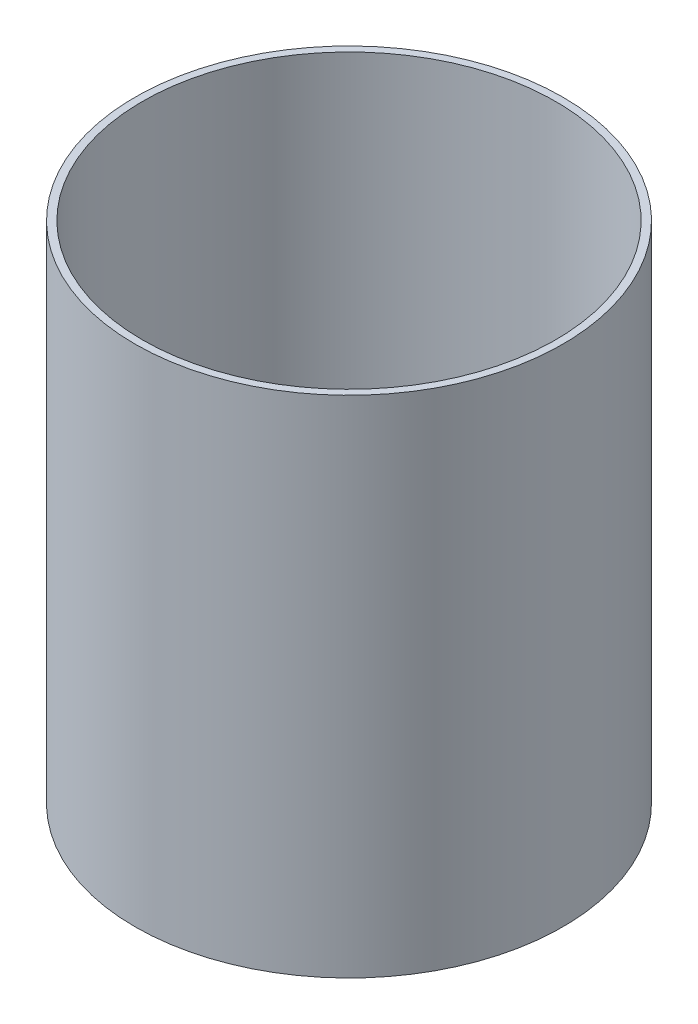
from build123d import *

# Parameters (mm, degrees)
SKETCH1_R           = 109.5375
SKETCH1_R_2         = 105.7783
BOSS_EXTRUDE1_DEPTH = 129.20750003


with BuildPart() as part:
    # Sketch1 → Boss-Extrude1 (new, symmetric)
    with BuildSketch(Plane(origin=(0, 0, 0), x_dir=(1, 0, 0), z_dir=(0, 1, 0))):
        Circle(SKETCH1_R)
        Circle(SKETCH1_R_2, mode=Mode.SUBTRACT)
    extrude(amount=BOSS_EXTRUDE1_DEPTH, both=True)


solid = part.part
